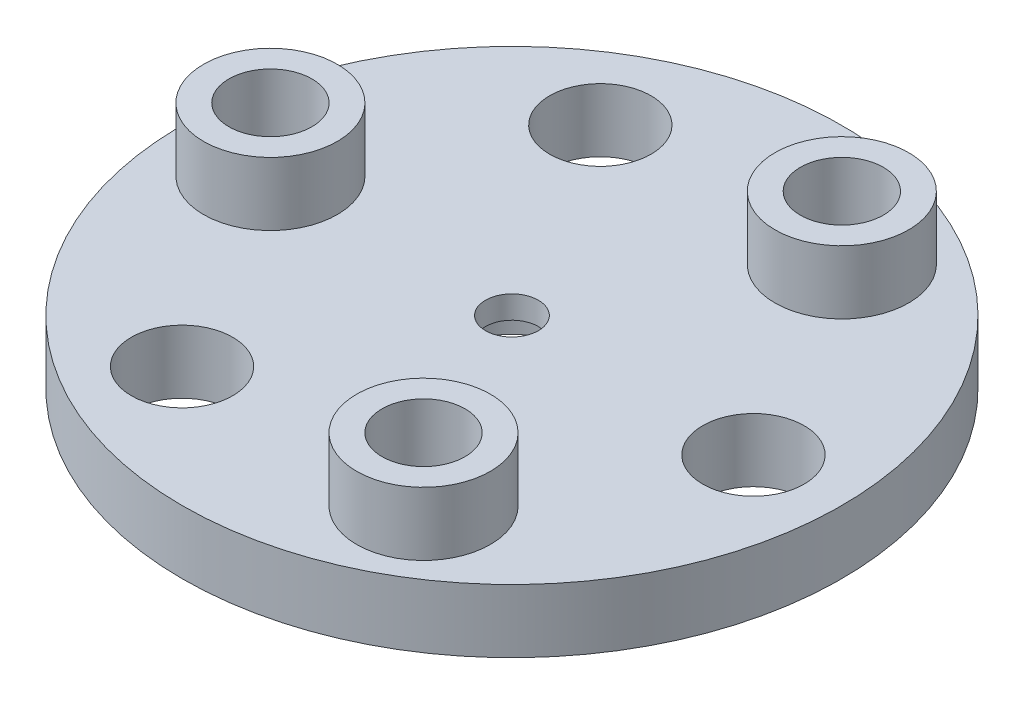
from build123d import *

# Parameters (mm, degrees)
SKETCH2_R           = 26
SKETCH2_R_2         = 2.085648148
BOSS_EXTRUDE2_DEPTH = 10
SKETCH3_R           = 3.275
CUT_EXTRUDE1_DEPTH  = 7.5
CUT_EXTRUDE2_START  = -5
SKETCH4_R           = 26
SKETCH4_R_2         = 5.275
CUT_EXTRUDE2_DEPTH  = 5
SKETCH5_R           = 5.25
CUT_EXTRUDE3_DEPTH  = 3.2
SKETCH8_R           = 4
CUT_EXTRUDE6_DEPTH  = 38.107950631


with BuildPart() as part:
    # Sketch2 → Boss-Extrude2 (new body)
    with BuildSketch(Plane(origin=(0, 0, 0), x_dir=(1, 0, 0), z_dir=(0, 1, 0))):
        Circle(SKETCH2_R)
        Circle(SKETCH2_R_2, mode=Mode.SUBTRACT)
    extrude(amount=BOSS_EXTRUDE2_DEPTH)

    # Sketch3 → Cut-Extrude1 (cut)
    with BuildSketch(Plane.XZ.offset(-10)):
        with Locations((9.52625, -16.499949006)):
            Circle(SKETCH3_R)
        with Locations((9.52625, 16.499949006)):
            Circle(SKETCH3_R)
        with Locations((-19.0525, 0)):
            Circle(SKETCH3_R)
    extrude(amount=CUT_EXTRUDE1_DEPTH, mode=Mode.SUBTRACT)

    # Sketch4 → Cut-Extrude2 (cut)
    with BuildSketch(Plane(origin=(0, 10, 0), x_dir=(1, 0, 0), z_dir=(0, 1, 0)).offset(CUT_EXTRUDE2_START)):
        Circle(SKETCH4_R)
        with Locations((-19.0525, 0)):
            Circle(SKETCH4_R_2, mode=Mode.SUBTRACT)
        with Locations((9.52625, -16.499949006)):
            Circle(SKETCH4_R_2, mode=Mode.SUBTRACT)
        with Locations((9.52625, 16.499949006)):
            Circle(SKETCH4_R_2, mode=Mode.SUBTRACT)
    extrude(amount=CUT_EXTRUDE2_DEPTH, mode=Mode.SUBTRACT)

    # Sketch5 → Cut-Extrude3 (cut)
    with BuildSketch(Plane.XZ):
        Circle(SKETCH5_R)
    extrude(amount=-CUT_EXTRUDE3_DEPTH, mode=Mode.SUBTRACT)

    # Sketch8 → Cut-Extrude6 (cut, through all)
    with BuildSketch(Plane(origin=(0, 5, 0), x_dir=(1, 0, 0), z_dir=(0, 1, 0))):
        with Locations((-9.52625, -16.499949006)):
            Circle(SKETCH8_R)
        with Locations((-9.52625, 16.499949006)):
            Circle(SKETCH8_R)
        with Locations((19.0525, 0)):
            Circle(SKETCH8_R)
    extrude(amount=-CUT_EXTRUDE6_DEPTH, mode=Mode.SUBTRACT)


solid = part.part
